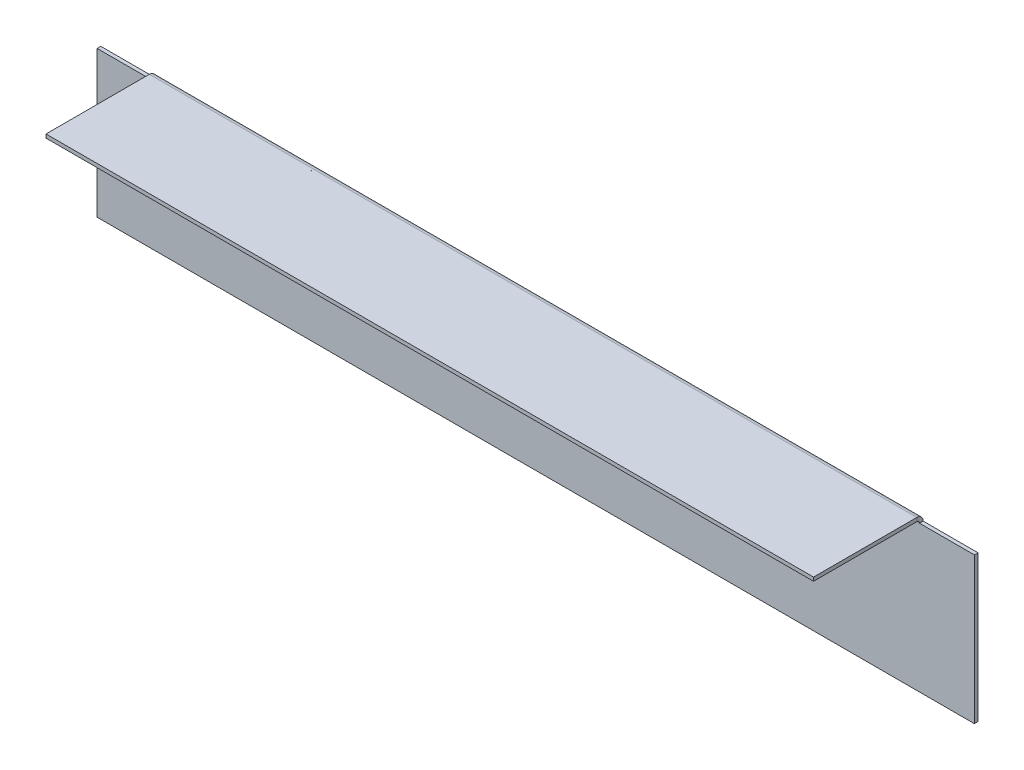
from build123d import *

# Parameters (mm, degrees)
SKETCH_1_W             = 240
SKETCH_1_H             = 40
SM_BASE_FLANGE_1_DEPTH = 1
SM_EDGE_FLANGE_1_DEPTH = 210


# Sheet-metal steps are written as plain solids
with BuildPart() as part:
    # Sketch 1 → 基体-法兰1 (new body)
    with BuildSketch(Plane.XY):
        Rectangle(SKETCH_1_W, SKETCH_1_H)
    extrude(amount=-SM_BASE_FLANGE_1_DEPTH)

    # 边线-法兰1 section (across the edge) → 边线-法兰1 (add)
    with BuildSketch(Plane(origin=(105, 20.7366, 0), x_dir=(0, -1, 0), z_dir=(-1, 0, 0))):
        with BuildLine():
            Line((-1, 0.7366), (-1, 29))
            Line((-1, 29), (0, 29))
            Line((0, 29), (0, 0.7366))
            ThreePointArc((0, 0.7366), (0.215745145, 0.215745145), (0.7366, 0))
            Line((0.7366, 0), (0.7366, -1))
            ThreePointArc((0.7366, -1), (-0.491361636, -0.491361636), (-1, 0.7366))
        make_face()
    extrude(amount=SM_EDGE_FLANGE_1_DEPTH)


solid = part.part
